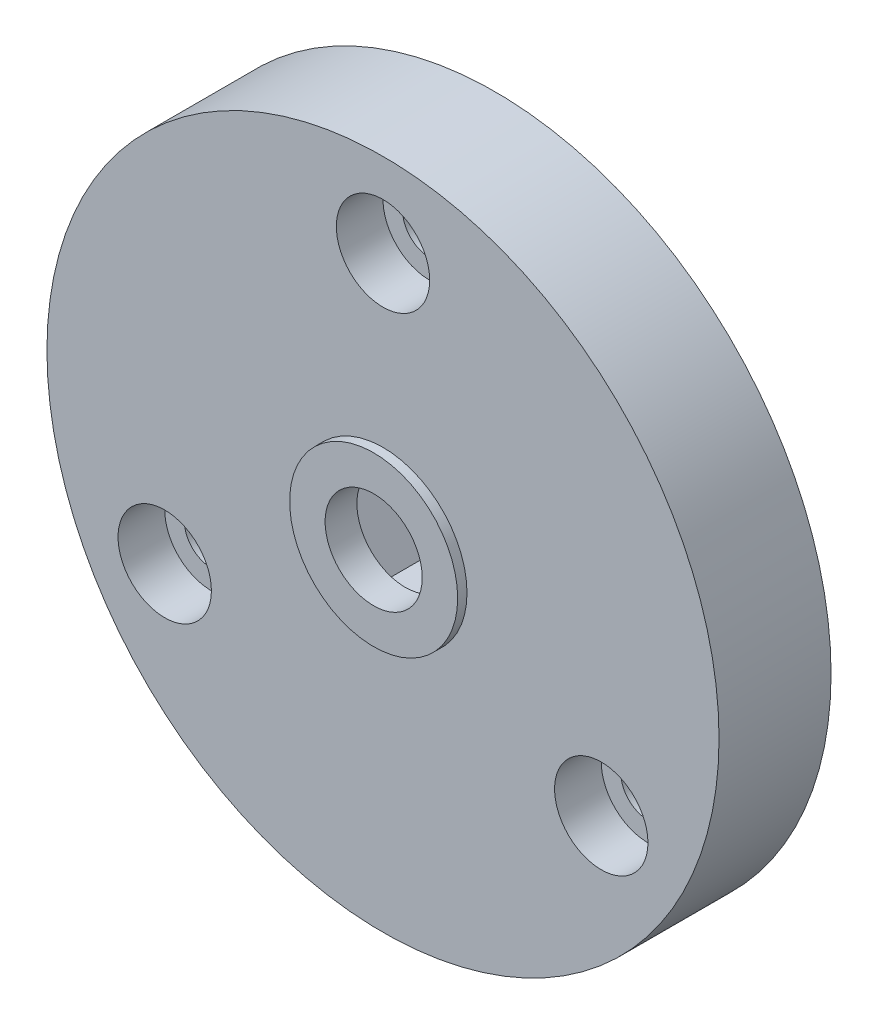
from build123d import *

# Parameters (mm, degrees)
SKETCH1_R           = 18
SKETCH1_R_2         = 2.6
SKETCH1_R_3         = 1.45
BOSS_EXTRUDE1_DEPTH = 6
SKETCH2_R           = 2.5
CUT_EXTRUDE1_DEPTH  = 2.51
SKETCH3_R           = 7.6
CUT_EXTRUDE2_DEPTH  = 1.2
CUT_EXTRUDE3_DEPTH  = 3.6
SKETCH5_R           = 4.5
SKETCH5_R_2         = 2.6
BOSS_EXTRUDE2_DEPTH = 0.5


with BuildPart() as part:
    # Sketch1 → Boss-Extrude1 (new body)
    with BuildSketch(Plane.XY.offset(322)):
        with Locations((300, 300)):
            Circle(SKETCH1_R)
        with Locations((300, 300)):
            Circle(SKETCH1_R_2, mode=Mode.SUBTRACT)
        with Locations((300, 313.5)):
            Circle(SKETCH1_R_3, mode=Mode.SUBTRACT)
        with Locations((288.308657049, 293.25)):
            Circle(SKETCH1_R_3, mode=Mode.SUBTRACT)
        with Locations((311.691342951, 293.25)):
            Circle(SKETCH1_R_3, mode=Mode.SUBTRACT)
    extrude(amount=BOSS_EXTRUDE1_DEPTH)

    # Sketch2 → Cut-Extrude1 (cut)
    with BuildSketch(Plane.XY.offset(325.5)):
        with Locations((300, 313.5)):
            Circle(SKETCH2_R)
        with Locations((288.308657049, 293.25)):
            Circle(SKETCH2_R)
        with Locations((311.691342951, 293.25)):
            Circle(SKETCH2_R)
    extrude(amount=CUT_EXTRUDE1_DEPTH, mode=Mode.SUBTRACT)

    # Sketch3 → Cut-Extrude2 (cut)
    with BuildSketch(Plane.XY.offset(322)):
        with Locations((300, 300)):
            Circle(SKETCH3_R)
    extrude(amount=CUT_EXTRUDE2_DEPTH, mode=Mode.SUBTRACT)

    # Sketch4 → Cut-Extrude3 (cut)
    with BuildSketch(Plane.XY.offset(323.2)):
        Polygon((304.734272207, 300), (302.367136104, 304.1), (297.632863896, 304.1), (295.265727793, 300), (297.632863896, 295.9), (302.367136104, 295.9), align=None)
    extrude(amount=CUT_EXTRUDE3_DEPTH, mode=Mode.SUBTRACT)

    # Sketch5 → Boss-Extrude2 (add)
    with BuildSketch(Plane.XY.offset(328)):
        with Locations((300, 300)):
            Circle(SKETCH5_R)
        with Locations((300, 300)):
            Circle(SKETCH5_R_2, mode=Mode.SUBTRACT)
    extrude(amount=BOSS_EXTRUDE2_DEPTH)


solid = part.part
